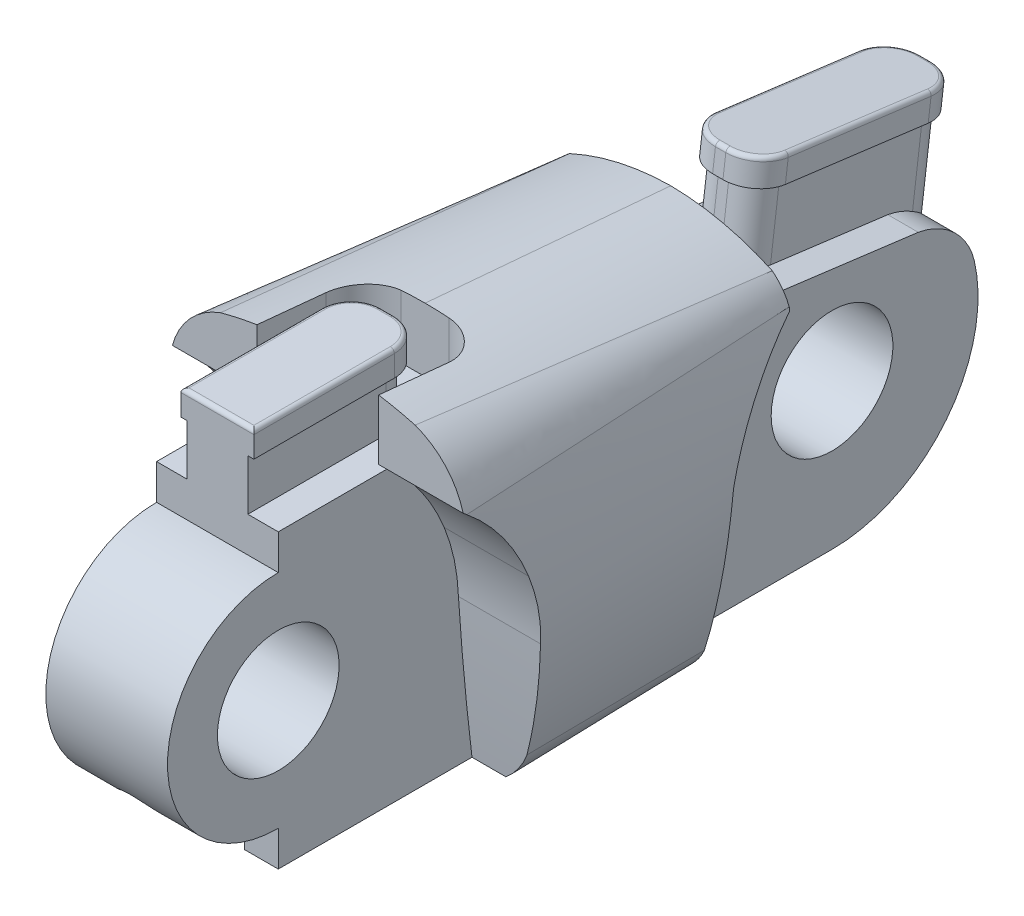
from build123d import *

# Parameters (mm, degrees)
SKETCH1_R           = 3.81
BOSS_EXTRUDE1_DEPTH = 3.81
CUT_EXTRUDE1_DEPTH  = 7.62
CUT_EXTRUDE2_DEPTH  = 7.62
CUT_EXTRUDE3_DEPTH  = 5.08
BOSS_EXTRUDE2_DEPTH = 3.175
BOSS_EXTRUDE3_DEPTH = 1.58496
FILLET1_R           = 0.254
BOSS_EXTRUDE4_START = -1.905
BOSS_EXTRUDE4_DEPTH = 6.223
BOSS_EXTRUDE5_DEPTH = 1.6383
FILLET2_R           = 0.254
SKETCH13_W          = 3.3782
SKETCH13_H          = 2.2098
CUT_EXTRUDE4_DEPTH  = 18.288
CUT_EXTRUDE5_DEPTH  = 17.7927
SKETCH15_R          = 1.6891
CUT_EXTRUDE6_DEPTH  = 38.388525894
CUT_EXTRUDE7_REACH  = 35.018


with BuildPart() as part:
    # Sketch1 → Boss-Extrude1 (new, symmetric)
    with BuildSketch(Plane(origin=(0, 0, 0), x_dir=(0, 0, -1), z_dir=(1, 0, 0))):
        with BuildLine():
            Line((-17.3355, 9.144), (17.3355, 9.144))
            ThreePointArc((17.3355, 9.144), (26.4795, 0), (17.3355, -9.144))
            Line((17.3355, -9.144), (-17.3355, -9.144))
            ThreePointArc((-17.3355, -9.144), (-26.4795, 0), (-17.3355, 9.144))
        make_face()
        with Locations(Location((-17.3355, 0, 0), (0, 0, 180))):
            Circle(SKETCH1_R, mode=Mode.SUBTRACT)
        with Locations(Location((17.3355, 0, 0), (0, 0, 180))):
            Circle(SKETCH1_R, mode=Mode.SUBTRACT)
    extrude(amount=BOSS_EXTRUDE1_DEPTH, both=True)

    # Sketch7 → Cut-Extrude2 (cut)
    with BuildSketch(Plane(origin=(3.81, 0, 0), x_dir=(0, 0, -1), z_dir=(1, 0, 0))):
        with BuildLine():
            Line((11.049, 11.811), (11.049, 6.858))
            Line((11.049, 6.858), (22.733, 5.352953508))
            ThreePointArc((22.733, 5.352953508), (24.964764192, 4.231118044), (26.239132975, 2.0828))
            ThreePointArc((26.239132975, 2.0828), (26.419209483, 1.048311994), (26.4795, 0))
            Line((26.4795, 0), (26.4795, 11.811))
            Line((26.4795, 11.811), (11.049, 11.811))
        make_face()
    extrude(amount=-CUT_EXTRUDE2_DEPTH, mode=Mode.SUBTRACT)



with BuildPart() as body_2:
    # Loft2: read off the stored shape, not the designer's step
    # Loft2: loft between two sections, ruled curve by curve
    loft2_from = [
        Edge.make_bspline([(1e-09, 11.811, -11.049), (-2.193891364, 11.789723931, -11.049), (-4.358423704, 11.302704155, -11.049), (-6.35, 10.38225, -11.049)], [0, 0, 0, 0, 1, 1, 1, 1], 3),
        Edge.make_bspline([(-6.35, 10.38225, -11.049), (-6.827120884, 10.010148199, -11.049), (-7.195580818, 9.516675072, -11.049), (-7.4168, 8.9535, -11.049)], [0, 0, 0, 0, 1, 1, 1, 1], 3),
        Edge.make_bspline([(6.35, 10.38225, -11.049), (4.358423705, 11.302704154, -11.049), (2.193891365, 11.789723931, -11.049), (1e-09, 11.811, -11.049)], [0, 0, 0, 0, 1, 1, 1, 1], 3),
        Edge.make_bspline([(-7.4168, 8.9535, -11.049), (-7.529347774, 8.328089634, -11.049), (-7.726103172, 7.06799717, -11.049), (-7.933341545, 5.159887229, -11.049), (-8.051129119, 3.244171138, -11.049), (-8.069876012, 1.968933888, -11.049), (-8.057734621, 0.533845698, -11.049), (-7.974964393, -1.060706348, -11.049), (-7.646107199, -3.426837682, -11.049), (-7.114920789, -5.755907355, -11.049), (-6.627116899, -7.276267347, -11.049), (-6.35, -8.0264, -11.049)], [0, 0, 0, 0, 0.110695965, 0.221391929, 0.332087894, 0.442783858, 0.442783858, 0.582087894, 0.721391929, 0.860695965, 1, 1, 1, 1], 3),
        Edge.make_bspline([(-6.35, -8.0264, -11.049), (-6.132291528, -8.455208388, -11.049), (-5.829851348, -8.8354189, -11.049), (-5.461, -9.144, -11.049)], [0, 0, 0, 0, 1, 1, 1, 1], 3),
        Edge.make_bspline([(5.461, -9.144, -11.049), (5.829851348, -8.8354189, -11.049), (6.132291528, -8.455208388, -11.049), (6.35, -8.0264, -11.049)], [0, 0, 0, 0, 1, 1, 1, 1], 3),
        Edge.make_bspline([(6.35, -8.0264, -11.049), (6.627116899, -7.276267347, -11.049), (7.114920789, -5.755907355, -11.049), (7.646107199, -3.426837682, -11.049), (7.974964393, -1.060706348, -11.049), (8.057734621, 0.533845698, -11.049), (8.069876012, 1.968933888, -11.049), (8.051129577, 3.244157113, -11.049), (7.933342971, 5.159870455, -11.049), (7.726105088, 7.067983269, -11.049), (7.529347774, 8.328089634, -11.049), (7.4168, 8.9535, -11.049)], [0, 0, 0, 0, 0.139304035, 0.278608071, 0.417912106, 0.557216142, 0.557216142, 0.667912106, 0.778608071, 0.889304035, 1, 1, 1, 1], 3),
        Edge.make_bspline([(7.4168, 8.9535, -11.049), (7.195580818, 9.516675072, -11.049), (6.827120884, 10.010148199, -11.049), (6.35, 10.38225, -11.049)], [0, 0, 0, 0, 1, 1, 1, 1], 3),
        Edge.make_line((5.461, -9.144, -11.049), (-5.461, -9.144, -11.049)),
    ]
    loft2_to = [
        Edge.make_bspline([(0, 13.716, 11.049), (-2.058139092, 13.729159689, 11.049), (-4.108753814, 13.464288621, 11.049), (-6.096, 12.9286, 11.049)], [0, 0, 0, 0, 1, 1, 1, 1], 3),
        Edge.make_bspline([(-6.096, 12.9286, 11.049), (-7.624913072, 12.372547932, 11.049), (-8.771034652, 11.083161156, 11.049), (-9.144, 9.4996, 11.049)], [0, 0, 0, 0, 1, 1, 1, 1], 3),
        Edge.make_bspline([(6.096, 12.9286, 11.049), (4.108753814, 13.464288621, 11.049), (2.058139092, 13.729159689, 11.049), (0, 13.716, 11.049)], [0, 0, 0, 0, 1, 1, 1, 1], 3),
        Edge.make_bspline([(-9.144, 9.4996, 11.049), (-9.184276727, 8.896342633, 11.049), (-9.252325631, 7.693681612, 11.049), (-9.317886478, 5.894875477, 11.049), (-9.347358144, 4.0951195, 11.049), (-9.342880608, 2.890542332, 11.049), (-9.323953522, 1.525220811, 11.049), (-9.247141801, -0.000189627, 11.049), (-8.963393507, -2.280671131, 11.049), (-8.512772164, -4.534123902, 11.049), (-8.104142056, -6.005789109, 11.049), (-7.874, -6.731, 11.049)], [0, 0, 0, 0, 0.110695965, 0.221391929, 0.332087894, 0.442783858, 0.442783858, 0.582087894, 0.721391929, 0.860695965, 1, 1, 1, 1], 3),
        Edge.make_bspline([(-7.874, -6.731, 11.049), (-7.482380865, -7.665670573, 11.049), (-6.87271021, -8.493080746, 11.049), (-6.096, -9.144, 11.049)], [0, 0, 0, 0, 1, 1, 1, 1], 3),
        Edge.make_bspline([(6.096, -9.144, 11.049), (6.87271021, -8.493080746, 11.049), (7.482380865, -7.665670573, 11.049), (7.874, -6.731, 11.049)], [0, 0, 0, 0, 1, 1, 1, 1], 3),
        Edge.make_bspline([(7.874, -6.731, 11.049), (8.104142056, -6.005789109, 11.049), (8.512772164, -4.534123902, 11.049), (8.963393507, -2.280671131, 11.049), (9.247141801, -0.000189627, 11.049), (9.323953522, 1.525220811, 11.049), (9.342880608, 2.890542332, 11.049), (9.347358103, 4.095118662, 11.049), (9.317886415, 5.894877856, 11.049), (9.252325716, 7.693680778, 11.049), (9.184276727, 8.896342633, 11.049), (9.144, 9.4996, 11.049)], [0, 0, 0, 0, 0.139304035, 0.278608071, 0.417912106, 0.557216142, 0.557216142, 0.667912106, 0.778608071, 0.889304035, 1, 1, 1, 1], 3),
        Edge.make_bspline([(9.144, 9.4996, 11.049), (8.771034652, 11.083161156, 11.049), (7.624913072, 12.372547932, 11.049), (6.096, 12.9286, 11.049)], [0, 0, 0, 0, 1, 1, 1, 1], 3),
        Edge.make_line((6.096, -9.144, 11.049), (-6.096, -9.144, 11.049)),
    ]
    loft2 = Solid(Shell([*[Face.make_surface_from_curves(loft2_from[k], loft2_to[k]) for k in range(9)], Face(Wire(loft2_from)), Face(Wire(loft2_to))]))
    add(loft2)

    # Sketch6 → Cut-Extrude1 (cut)
    with BuildSketch(Plane(origin=(3.81, 0, 0), x_dir=(0, 0, -1), z_dir=(1, 0, 0))):
        with BuildLine():
            Line((-11.049, -9.144), (-5.207, -9.144))
            ThreePointArc((-5.207, -9.144), (-5.693940013, -4.577842218), (-6.054866738, 0))
            ThreePointArc((-6.054866738, 0), (-6.319168605, 2.134177073), (-6.9469, 4.191))
            ThreePointArc((-6.9469, 4.191), (-8.638848534, 7.19124366), (-11.049, 9.652))
            Line((-11.049, 9.652), (-11.049, -9.144))
        make_face()
        with BuildLine():
            Line((11.049, -9.144), (11.049, 8.763))
            ThreePointArc((11.049, 8.763), (8.24302166, 5.656415958), (6.6675, 1.778))
            ThreePointArc((6.6675, 1.778), (6.356792996, -3.681378157), (6.604, -9.144))
            Line((6.604, -9.144), (11.049, -9.144))
        make_face()
    cut_extrude1 = extrude(amount=CUT_EXTRUDE1_DEPTH, mode=Mode.SUBTRACT)

    # Mirror1: Cut-Extrude1 across plane
    add(cut_extrude1.mirror(Plane(origin=(0, 0, 0), x_dir=(0, 0, 1), z_dir=(1, 0, 0))), mode=Mode.SUBTRACT)

    # Sketch8 → Cut-Extrude3 (cut)
    with BuildSketch(Plane(origin=(0, 9.144, 0), x_dir=(1, 0, 0), z_dir=(0, 1, 0))):
        with BuildLine():
            Line((-3.81, -11.049), (-3.81, -6.731))
            ThreePointArc((-3.81, -6.731), (-3.138206464, -5.064865998), (-1.4986, -4.3307))
            Line((-1.4986, -4.3307), (1.4986, -4.3307))
            ThreePointArc((1.4986, -4.3307), (3.164734002, -5.039320961), (3.81, -6.731))
            Line((3.81, -6.731), (3.81, -11.049))
            Line((3.81, -11.049), (-3.81, -11.049))
        make_face()
    extrude(amount=CUT_EXTRUDE3_DEPTH, mode=Mode.SUBTRACT)


with BuildPart() as part_1:
    add(part.part)

    add(body_2.part)  # Boss-Extrude2 merges body 2
    # Sketch9 → Boss-Extrude2 (add)
    with BuildSketch(Plane(origin=(0, 9.144, 0), x_dir=(1, 0, 0), z_dir=(0, 1, 0))):
        with BuildLine():
            Line((1.905, -17.3355), (1.905, -8.6995))
            ThreePointArc((1.905, -8.6995), (1.445873179, -7.557029289), (0.32385, -7.049978258))
            Line((0.32385, -7.049978258), (-0.32385, -7.049978258))
            ThreePointArc((-0.32385, -7.049978258), (-1.445873179, -7.557029289), (-1.905, -8.6995))
            Line((-1.905, -8.6995), (-1.905, -17.3355))
            Line((-1.905, -17.3355), (1.905, -17.3355))
        make_face()
    extrude(amount=BOSS_EXTRUDE2_DEPTH)

    # Sketch10 → Boss-Extrude3 (add)
    with BuildSketch(Plane(origin=(0, 12.319, 0), x_dir=(1, 0, 0), z_dir=(0, 1, 0))):
        with BuildLine():
            Line((-2.286, -17.3355), (2.286, -17.3355))
            Line((2.286, -17.3355), (2.286, -8.542730935))
            ThreePointArc((2.286, -8.542730935), (1.737190547, -7.217787711), (0.412247323, -6.668978258))
            Line((0.412247323, -6.668978258), (-0.412247323, -6.668978258))
            ThreePointArc((-0.412247323, -6.668978258), (-1.737190547, -7.217787711), (-2.286, -8.542730935))
            Line((-2.286, -8.542730935), (-2.286, -17.3355))
        make_face()
    extrude(amount=BOSS_EXTRUDE3_DEPTH)

    # Fillet1
    fillet1_edges = [part_1.edges().sort_by_distance(p)[0] for p in [
        (-2.286, 13.90396, 12.939115467),
        (0, 13.90396, 17.3355),
        (2.286, 13.90396, 12.939115467),
        (1.737190547, 13.90396, 7.217787711),
        (0, 13.90396, 6.668978258),
        (-1.737190547, 13.90396, 7.217787711),
    ]]
    fillet(fillet1_edges, radius=FILLET1_R)

    # Sketch11 → Boss-Extrude4 (add)
    with BuildSketch(Plane(origin=(0, 8.146085043, -1.049318446), x_dir=(1, 0, 0), z_dir=(0, 0.9918054930472712, -0.1277570505344402)).offset(BOSS_EXTRUDE4_START)):
        with BuildLine():
            Line((-0.32385, 12.87630104), (0.32385, 12.87630104))
            ThreePointArc((0.32385, 12.87630104), (1.441891887, 13.339409153), (1.905, 14.45745104))
            Line((1.905, 14.45745104), (1.905, 23.47445104))
            ThreePointArc((1.905, 23.47445104), (1.441891887, 24.592492927), (0.32385, 25.05560104))
            Line((0.32385, 25.05560104), (-0.32385, 25.05560104))
            ThreePointArc((-0.32385, 25.05560104), (-1.441891887, 24.592492927), (-1.905, 23.47445104))
            Line((-1.905, 23.47445104), (-1.905, 14.45745104))
            ThreePointArc((-1.905, 14.45745104), (-1.441891887, 13.339409153), (-0.32385, 12.87630104))
        make_face()
    extrude(amount=BOSS_EXTRUDE4_DEPTH)

    # Sketch12 → Boss-Extrude5 (add)
    with BuildSketch(Plane(origin=(0, 12.428701162, -1.60097339), x_dir=(1, 0, 0), z_dir=(0, 0.9918054930472712, -0.12775705053444023))):
        with BuildLine():
            Line((2.286, 14.45745104), (2.286, 23.47445104))
            ThreePointArc((2.286, 23.47445104), (1.711299571, 24.861900611), (0.32385, 25.43660104))
            Line((0.32385, 25.43660104), (-0.32385, 25.43660104))
            ThreePointArc((-0.32385, 25.43660104), (-1.711299571, 24.861900611), (-2.286, 23.47445104))
            Line((-2.286, 23.47445104), (-2.286, 14.45745104))
            ThreePointArc((-2.286, 14.45745104), (-1.711299571, 13.070001469), (-0.32385, 12.49530104))
            Line((-0.32385, 12.49530104), (0.32385, 12.49530104))
            ThreePointArc((0.32385, 12.49530104), (1.711299571, 13.070001469), (2.286, 14.45745104))
        make_face()
    extrude(amount=BOSS_EXTRUDE5_DEPTH)

    # Fillet2
    fillet2_edges = [part_1.edges().sort_by_distance(p)[0] for p in [
        (1.711299571, 12.383791264, -14.773177017),
        (2.286, 11.630542136, -20.620812188),
        (1.711299571, 10.877293009, -26.468447359),
        (0, 10.803870977, -27.038438402),
        (-1.711299571, 10.877293009, -26.468447359),
        (-2.286, 11.630542136, -20.620812188),
        (-1.711299571, 12.383791264, -14.773177017),
        (0, 12.457213295, -14.203185975),
    ]]
    fillet(fillet2_edges, radius=FILLET2_R)

    # Sketch13 → Cut-Extrude4 (cut)
    with BuildSketch(Plane(origin=(0, 9.144, 0), x_dir=(1, 0, 0), z_dir=(0, 1, 0))):
        with Locations((0, -25.3746)):
            Rectangle(SKETCH13_W, SKETCH13_H)
    extrude(amount=-CUT_EXTRUDE4_DEPTH, mode=Mode.SUBTRACT)

    # Sketch14 → Cut-Extrude5 (cut)
    with BuildSketch(Plane.XY.offset(24.2697)):
        with BuildLine():
            Line((-1.6891, -9.144), (1.6891, -9.144))
            Line((1.6891, -9.144), (1.6891, -5.960671637))
            ThreePointArc((1.6891, -5.960671637), (0, -4.271571637), (-1.6891, -5.960671637))
            Line((-1.6891, -5.960671637), (-1.6891, -9.144))
        make_face()
    cut_extrude5 = extrude(amount=-CUT_EXTRUDE5_DEPTH, mode=Mode.SUBTRACT)

    # Mirror2: Cut-Extrude5 across plane
    add(cut_extrude5.mirror(Plane.XY), mode=Mode.SUBTRACT)

    # Sketch15 → Cut-Extrude6 (cut, through all)
    with BuildSketch(Plane.XY.offset(6.477)):
        with Locations((0, -5.960671637)):
            Circle(SKETCH15_R)
    extrude(amount=-CUT_EXTRUDE6_DEPTH, mode=Mode.SUBTRACT)

    # Cut-Extrude7: up to this face of the body (flat: up to its plane)
    cut_extrude7_end = Plane(part_1.part.faces().sort_by_distance((-3.81, 8.863470109, 13.887646262))[0])
    # Sketch16 → Cut-Extrude7 (cut, up to the picked face)
    with BuildSketch(Plane(origin=(3.81, 0, 0), x_dir=(0, 0, -1), z_dir=(1, 0, 0)), mode=Mode.PRIVATE) as cut_extrude7_sk1:
        with BuildLine():
            Line((-17.3355, 9.144), (-17.3355, 6.9342))
            ThreePointArc((-17.3355, 6.9342), (-24.2697, 0), (-17.3355, -6.9342))
            Line((-17.3355, -6.9342), (-17.3355, -9.144))
            ThreePointArc((-17.3355, -9.144), (-26.4795, 0), (-17.3355, 9.144))
        make_face()
    cut_extrude7_tool1 = split(extrude(cut_extrude7_sk1.sketch, amount=-CUT_EXTRUDE7_REACH, mode=Mode.PRIVATE), bisect_by=cut_extrude7_end, keep=Keep.BOTH, mode=Mode.PRIVATE)
    add(cut_extrude7_tool1.solids().sort_by(Axis((3.81, 0, 26.275034), (-1, 0, 0)))[0], mode=Mode.SUBTRACT)


solid = part_1.part
